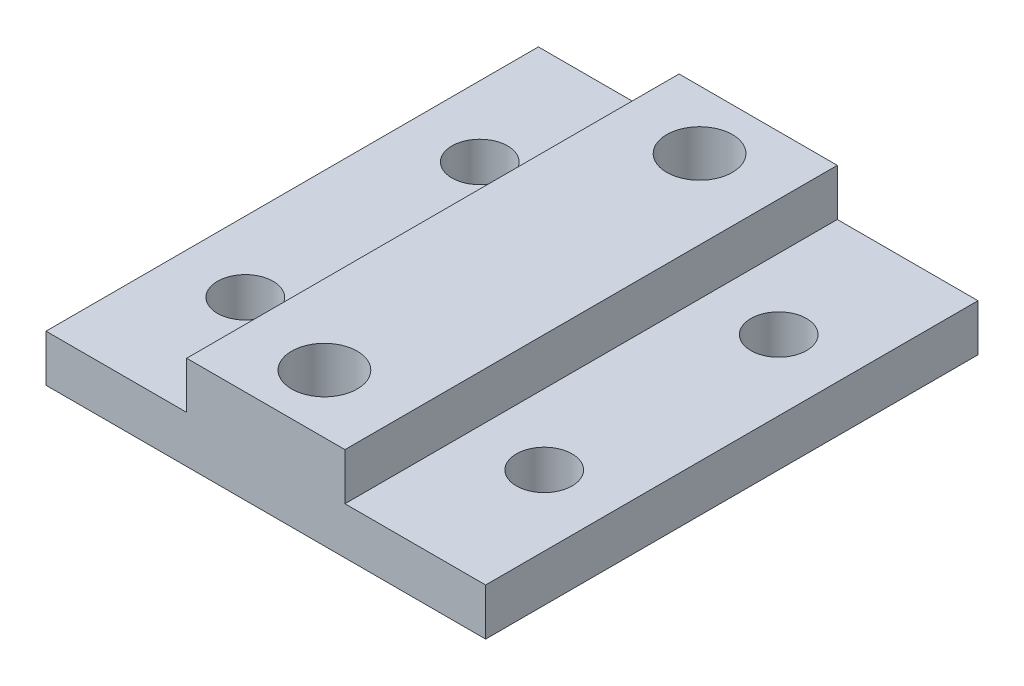
from build123d import *

# Parameters (mm, degrees)
ESBO_O1_W                = 12
ESBO_O1_H                = 42
ESBO_O1_R                = 2.375
ESBO_O1_W_2              = 13.5
ESBO_O1_R_2              = 2.8
RESSALTO_EXTRUS_O1_DEPTH = 5
CORTE_EXTRUS_O1_START    = -5
CORTE_EXTRUS_O1_DEPTH    = 4
RESSALTO_EXTRUS_O2_START = 5
ESBO_O1_3_W              = 13.5
ESBO_O1_3_H              = 42
ESBO_O1_3_R              = 2.8
RESSALTO_EXTRUS_O2_DEPTH = 4


with BuildPart() as part:
    # Esboço1 → Ressalto-extrusão1 (new body)
    # profile 1 of 3: a face of its own
    with BuildSketch(Plane(origin=(0, 0, 0), x_dir=(1, 0, 0), z_dir=(0, 1, 0))):
        with Locations((-12.75, 0)):
            Rectangle(ESBO_O1_W, ESBO_O1_H)
        with Locations(Location((-12.75, -10, 0), (0, 0, 270))):
            Circle(ESBO_O1_R, mode=Mode.SUBTRACT)
        with Locations(Location((-12.75, 10, 0), (0, 0, 270))):
            Circle(ESBO_O1_R, mode=Mode.SUBTRACT)
    # profile 2 of 3: a face of its own
    with BuildSketch(Plane(origin=(0, 0, 0), x_dir=(1, 0, 0), z_dir=(0, 1, 0))):
        Rectangle(ESBO_O1_W_2, ESBO_O1_H)
        with Locations(Location((0, -16, 0), (0, 0, 270))):
            Circle(ESBO_O1_R_2, mode=Mode.SUBTRACT)
        with Locations(Location((0, 16, 0), (0, 0, 270))):
            Circle(ESBO_O1_R_2, mode=Mode.SUBTRACT)
    # profile 3 of 3: a face of its own
    with BuildSketch(Plane(origin=(0, 0, 0), x_dir=(1, 0, 0), z_dir=(0, 1, 0))):
        with Locations((12.75, 0)):
            Rectangle(ESBO_O1_W, ESBO_O1_H)
        with Locations(Location((12.75, -10, 0), (0, 0, 270))):
            Circle(ESBO_O1_R, mode=Mode.SUBTRACT)
        with Locations(Location((12.75, 10, 0), (0, 0, 270))):
            Circle(ESBO_O1_R, mode=Mode.SUBTRACT)
    extrude(amount=RESSALTO_EXTRUS_O1_DEPTH)

    # Esboço2 → Corte-extrusão1 (cut)
    with BuildSketch(Plane(origin=(0, 5, 0), x_dir=(1, 0, 0), z_dir=(0, 1, 0)).offset(CORTE_EXTRUS_O1_START)):
        Polygon((5.022947342, 16), (2.511473671, 20.35), (-2.511473671, 20.35), (-5.022947342, 16), (-2.511473671, 11.65), (2.511473671, 11.65), align=None)
        Polygon((5.022947342, -16), (2.511473671, -11.65), (-2.511473671, -11.65), (-5.022947342, -16), (-2.511473671, -20.35), (2.511473671, -20.35), align=None)
    extrude(amount=CORTE_EXTRUS_O1_DEPTH, mode=Mode.SUBTRACT)

    # Esboço1<3> → Ressalto-extrusão2 (add)
    with BuildSketch(Plane(origin=(0, 0, 0), x_dir=(1, 0, 0), z_dir=(0, 1, 0)).offset(RESSALTO_EXTRUS_O2_START)):
        Rectangle(ESBO_O1_3_W, ESBO_O1_3_H)
        with Locations(Location((0, -16, 0), (0, 0, 270))):
            Circle(ESBO_O1_3_R, mode=Mode.SUBTRACT)
        with Locations(Location((0, 16, 0), (0, 0, 270))):
            Circle(ESBO_O1_3_R, mode=Mode.SUBTRACT)
    extrude(amount=RESSALTO_EXTRUS_O2_DEPTH)

    # Chanfro1
    # the kernel refuses this chamfer: 1 mm, written as the material it takes off along each edge
    with BuildSketch(Plane(origin=(12.75, 0, -10), x_dir=(0, 0, 1), z_dir=(-1, 0, 0))) as chanfro1_piece_1:
        with BuildLine():
            Line((2.346715729, 1.028284271), (3.403284271, -0.028284271))
            Line((3.403284271, -0.028284271), (3.403284271, -0.048284271))
            ThreePointArc((3.403284271, -0.048284271), (2.889142136, -0.02), (2.375, -0.02))
            Line((2.375, -0.02), (2.355, 0))
            ThreePointArc((2.355, 0), (2.355, 0.514142136), (2.326715729, 1.028284271))
            Line((2.326715729, 1.028284271), (2.346715729, 1.028284271))
        make_face()
    revolve(axis=Axis((12.75, 0, -10), (0, 1, 0)), mode=Mode.SUBTRACT)
    with BuildSketch(Plane(origin=(12.75, 0, 10), x_dir=(0, 0, 1), z_dir=(-1, 0, 0))) as chanfro1_piece_2:
        with BuildLine():
            Line((2.346715729, 1.028284271), (3.403284271, -0.028284271))
            Line((3.403284271, -0.028284271), (3.403284271, -0.048284271))
            ThreePointArc((3.403284271, -0.048284271), (2.889142136, -0.02), (2.375, -0.02))
            Line((2.375, -0.02), (2.355, 0))
            ThreePointArc((2.355, 0), (2.355, 0.514142136), (2.326715729, 1.028284271))
            Line((2.326715729, 1.028284271), (2.346715729, 1.028284271))
        make_face()
    revolve(axis=Axis((12.75, 0, 10), (0, 1, 0)), mode=Mode.SUBTRACT)
    with BuildSketch(Plane(origin=(-18.75, 0, -21), x_dir=(0.9996219169112968, -0.02749587661058639, 0), z_dir=(0, 0, 1))) as chanfro1_piece_3:
        with BuildLine():
            Line((1.028673195, 0), (-0.056547155, 1.027117794))
            Line((-0.056547155, 1.027117794), (-0.076539593, 1.026567876))
            ThreePointArc((-0.076539593, 1.026567876), (-0.034129227, 0.51339783), (-0.019992438, -0.000549918))
            Line((-0.019992438, -0.000549918), (0.000549918, -0.019992438))
            ThreePointArc((0.000549918, -0.019992438), (0.514497665, -0.00585565), (1.029223113, -0.019992438))
            Line((1.029223113, -0.019992438), (1.028673195, 0))
        make_face()
    extrude(amount=42, mode=Mode.SUBTRACT)
    with BuildSketch(Plane(origin=(18.75, 0, -21), x_dir=(0, 0.9996219169112968, -0.02749587661058563), z_dir=(-1, 0, 0))) as chanfro1_piece_4:
        with BuildLine():
            Line((1.028673195, 0), (-0.056547155, -1.027117794))
            Line((-0.056547155, -1.027117794), (-0.076539593, -1.026567876))
            ThreePointArc((-0.076539593, -1.026567876), (-0.034129227, -0.51339783), (-0.019992438, 0.000549918))
            Line((-0.019992438, 0.000549918), (0.000549918, 0.019992438))
            ThreePointArc((0.000549918, 0.019992438), (0.514497665, 0.00585565), (1.029223113, 0.019992438))
            Line((1.029223113, 0.019992438), (1.028673195, 0))
        make_face()
    extrude(amount=37.5, mode=Mode.SUBTRACT)
    with BuildSketch(Plane(origin=(18.75, 0, 21), x_dir=(0.02749587661058563, 0.9996219169112968, 0), z_dir=(0, 0, -1))) as chanfro1_piece_5:
        with BuildLine():
            Line((1.028673195, 0), (-0.056547155, -1.027117794))
            Line((-0.056547155, -1.027117794), (-0.076539593, -1.026567876))
            ThreePointArc((-0.076539593, -1.026567876), (-0.034129227, -0.51339783), (-0.019992438, 0.000549918))
            Line((-0.019992438, 0.000549918), (0.000549918, 0.019992438))
            ThreePointArc((0.000549918, 0.019992438), (0.514497665, 0.00585565), (1.029223113, 0.019992438))
            Line((1.029223113, 0.019992438), (1.028673195, 0))
        make_face()
    extrude(amount=42, mode=Mode.SUBTRACT)
    with BuildSketch(Plane(origin=(18.75, 0, 21), x_dir=(0, 0.999621916911297, 0.027495876610582174), z_dir=(-1, 0, 0))) as chanfro1_piece_6:
        with BuildLine():
            Line((1.028673195, 0), (-0.056547155, 1.027117794))
            Line((-0.056547155, 1.027117794), (-0.076539593, 1.026567876))
            ThreePointArc((-0.076539593, 1.026567876), (-0.034129227, 0.51339783), (-0.019992438, -0.000549918))
            Line((-0.019992438, -0.000549918), (0.000549918, -0.019992438))
            ThreePointArc((0.000549918, -0.019992438), (0.514497665, -0.00585565), (1.029223113, -0.019992438))
            Line((1.029223113, -0.019992438), (1.028673195, 0))
        make_face()
    extrude(amount=37.5, mode=Mode.SUBTRACT)
    with BuildSketch(Plane(origin=(-12.75, 0, -10), x_dir=(0, 0, 1), z_dir=(-1, 0, 0))) as chanfro1_piece_7:
        with BuildLine():
            Line((2.346715729, 1.028284271), (3.403284271, -0.028284271))
            Line((3.403284271, -0.028284271), (3.403284271, -0.048284271))
            ThreePointArc((3.403284271, -0.048284271), (2.889142136, -0.02), (2.375, -0.02))
            Line((2.375, -0.02), (2.355, 0))
            ThreePointArc((2.355, 0), (2.355, 0.514142136), (2.326715729, 1.028284271))
            Line((2.326715729, 1.028284271), (2.346715729, 1.028284271))
        make_face()
    revolve(axis=Axis((-12.75, 0, -10), (0, 1, 0)), mode=Mode.SUBTRACT)
    with BuildSketch(Plane(origin=(-12.75, 0, 10), x_dir=(0, 0, 1), z_dir=(-1, 0, 0))) as chanfro1_piece_8:
        with BuildLine():
            Line((2.346715729, 1.028284271), (3.403284271, -0.028284271))
            Line((3.403284271, -0.028284271), (3.403284271, -0.048284271))
            ThreePointArc((3.403284271, -0.048284271), (2.889142136, -0.02), (2.375, -0.02))
            Line((2.375, -0.02), (2.355, 0))
            ThreePointArc((2.355, 0), (2.355, 0.514142136), (2.326715729, 1.028284271))
            Line((2.326715729, 1.028284271), (2.346715729, 1.028284271))
        make_face()
    revolve(axis=Axis((-12.75, 0, 10), (0, 1, 0)), mode=Mode.SUBTRACT)
    with BuildSketch(Plane(origin=(1.225632177, 0, -9.422857202), x_dir=(-0.023812127644090058, 0.9996219169112968, -0.013747938305293108), z_dir=(0.4999999999999996, 0, -0.8660254037844389))) as chanfro1_piece_9_section:
        with BuildLine():
            Line((1.028673195, 0), (-0.056547155, 1.027117794))
            Line((-0.056547155, 1.027117794), (-0.076539593, 1.026567876))
            ThreePointArc((-0.076539593, 1.026567876), (-0.034129227, 0.51339783), (-0.019992438, -0.000549918))
            Line((-0.019992438, -0.000549918), (0.000549918, -0.019992438))
            ThreePointArc((0.000549918, -0.019992438), (0.514497665, -0.00585565), (1.029223113, -0.019992438))
            Line((1.029223113, -0.019992438), (1.028673195, 0))
        make_face()
    chanfro1_piece_9 = extrude(amount=10.166313318, mode=Mode.PRIVATE)
    chanfro1_piece_9 = split(chanfro1_piece_9, bisect_by=Plane(origin=(4.039140565, 0.338238152, -11.65), z_dir=(0, 0, -1)), keep=Keep.TOP, mode=Mode.PRIVATE)
    chanfro1_piece_9 = split(chanfro1_piece_9, bisect_by=Plane(origin=(5.786780789, 0.338238152, -14.677001661), z_dir=(-0.8660254037844387, 0, 0.49999999999999994)), keep=Keep.TOP, mode=Mode.PRIVATE)
    add(chanfro1_piece_9, mode=Mode.SUBTRACT)
    with BuildSketch(Plane(origin=(6.308788836, 0, -13.772857202), x_dir=(-0.023812127644088424, 0.9996219169112968, 0.013747938305292178), z_dir=(-0.49999999999999994, 0, -0.8660254037844387))) as chanfro1_piece_10_section:
        with BuildLine():
            Line((1.028673195, 0), (-0.056547155, 1.027117794))
            Line((-0.056547155, 1.027117794), (-0.076539593, 1.026567876))
            ThreePointArc((-0.076539593, 1.026567876), (-0.034129227, 0.51339783), (-0.019992438, -0.000549918))
            Line((-0.019992438, -0.000549918), (0.000549918, -0.019992438))
            ThreePointArc((0.000549918, -0.019992438), (0.514497665, -0.00585565), (1.029223113, -0.019992438))
            Line((1.029223113, -0.019992438), (1.028673195, 0))
        make_face()
    chanfro1_piece_10 = extrude(amount=10.166313318, mode=Mode.PRIVATE)
    chanfro1_piece_10 = split(chanfro1_piece_10, bisect_by=Plane(origin=(4.039140565, 0.338238152, -20.35), z_dir=(0, 0, 1)), keep=Keep.TOP, mode=Mode.PRIVATE)
    chanfro1_piece_10 = split(chanfro1_piece_10, bisect_by=Plane(origin=(5.786780789, 0.338238152, -17.322998339), z_dir=(-0.8660254037844389, 0, -0.4999999999999996)), keep=Keep.TOP, mode=Mode.PRIVATE)
    add(chanfro1_piece_10, mode=Mode.SUBTRACT)
    with BuildSketch(Plane(origin=(5.083156659, 0, -20.35), x_dir=(0, 0.9996219169112968, 0.02749587661058563), z_dir=(-1, 0, 0))) as chanfro1_piece_11_section:
        with BuildLine():
            Line((1.028673195, 0), (-0.056547155, 1.027117794))
            Line((-0.056547155, 1.027117794), (-0.076539593, 1.026567876))
            ThreePointArc((-0.076539593, 1.026567876), (-0.034129227, 0.51339783), (-0.019992438, -0.000549918))
            Line((-0.019992438, -0.000549918), (0.000549918, -0.019992438))
            ThreePointArc((0.000549918, -0.019992438), (0.514497665, -0.00585565), (1.029223113, -0.019992438))
            Line((1.029223113, -0.019992438), (1.028673195, 0))
        make_face()
    chanfro1_piece_11 = extrude(amount=10.166313318, mode=Mode.PRIVATE)
    chanfro1_piece_11 = split(chanfro1_piece_11, bisect_by=Plane(origin=(-1.747640224, 0.338238152, -21.672998339), z_dir=(0.8660254037844389, 0, 0.49999999999999967)), keep=Keep.TOP, mode=Mode.PRIVATE)
    chanfro1_piece_11 = split(chanfro1_piece_11, bisect_by=Plane(origin=(1.747640224, 0.338238152, -21.672998339), z_dir=(-0.8660254037844387, 0, 0.49999999999999994)), keep=Keep.TOP, mode=Mode.PRIVATE)
    add(chanfro1_piece_11, mode=Mode.SUBTRACT)
    with BuildSketch(Plane(origin=(-1.225632177, 0, -22.577142798), x_dir=(0.023812127644090766, 0.9996219169112968, 0.013747938305293517), z_dir=(-0.49999999999999967, 0, 0.8660254037844389))) as chanfro1_piece_12_section:
        with BuildLine():
            Line((1.028673195, 0), (-0.056547155, 1.027117794))
            Line((-0.056547155, 1.027117794), (-0.076539593, 1.026567876))
            ThreePointArc((-0.076539593, 1.026567876), (-0.034129227, 0.51339783), (-0.019992438, -0.000549918))
            Line((-0.019992438, -0.000549918), (0.000549918, -0.019992438))
            ThreePointArc((0.000549918, -0.019992438), (0.514497665, -0.00585565), (1.029223113, -0.019992438))
            Line((1.029223113, -0.019992438), (1.028673195, 0))
        make_face()
    chanfro1_piece_12 = extrude(amount=10.166313318, mode=Mode.PRIVATE)
    chanfro1_piece_12 = split(chanfro1_piece_12, bisect_by=Plane(origin=(-5.786780789, 0.338238152, -17.322998339), z_dir=(0.8660254037844387, 0, -0.5000000000000001)), keep=Keep.TOP, mode=Mode.PRIVATE)
    chanfro1_piece_12 = split(chanfro1_piece_12, bisect_by=Plane(origin=(-4.039140565, 0.338238152, -20.35), z_dir=(0, 0, 1)), keep=Keep.TOP, mode=Mode.PRIVATE)
    add(chanfro1_piece_12, mode=Mode.SUBTRACT)
    with BuildSketch(Plane(origin=(-6.308788836, 0, -18.227142798), x_dir=(0.02381212764409112, 0.9996219169112968, -0.01374793830529374), z_dir=(0.5000000000000001, 0, 0.8660254037844387))) as chanfro1_piece_13_section:
        with BuildLine():
            Line((1.028673195, 0), (-0.056547155, 1.027117794))
            Line((-0.056547155, 1.027117794), (-0.076539593, 1.026567876))
            ThreePointArc((-0.076539593, 1.026567876), (-0.034129227, 0.51339783), (-0.019992438, -0.000549918))
            Line((-0.019992438, -0.000549918), (0.000549918, -0.019992438))
            ThreePointArc((0.000549918, -0.019992438), (0.514497665, -0.00585565), (1.029223113, -0.019992438))
            Line((1.029223113, -0.019992438), (1.028673195, 0))
        make_face()
    chanfro1_piece_13 = extrude(amount=10.166313318, mode=Mode.PRIVATE)
    chanfro1_piece_13 = split(chanfro1_piece_13, bisect_by=Plane(origin=(-5.786780789, 0.338238152, -14.677001661), z_dir=(0.8660254037844389, 0, 0.49999999999999967)), keep=Keep.TOP, mode=Mode.PRIVATE)
    chanfro1_piece_13 = split(chanfro1_piece_13, bisect_by=Plane(origin=(-4.039140565, 0.338238152, -11.65), z_dir=(0, 0, -1)), keep=Keep.TOP, mode=Mode.PRIVATE)
    add(chanfro1_piece_13, mode=Mode.SUBTRACT)
    with BuildSketch(Plane(origin=(-5.083156659, 0, -11.65), x_dir=(0, 0.9996219169112968, -0.02749587661058563), z_dir=(1, 0, 0))) as chanfro1_piece_14_section:
        with BuildLine():
            Line((1.028673195, 0), (-0.056547155, 1.027117794))
            Line((-0.056547155, 1.027117794), (-0.076539593, 1.026567876))
            ThreePointArc((-0.076539593, 1.026567876), (-0.034129227, 0.51339783), (-0.019992438, -0.000549918))
            Line((-0.019992438, -0.000549918), (0.000549918, -0.019992438))
            ThreePointArc((0.000549918, -0.019992438), (0.514497665, -0.00585565), (1.029223113, -0.019992438))
            Line((1.029223113, -0.019992438), (1.028673195, 0))
        make_face()
    chanfro1_piece_14 = extrude(amount=10.166313318, mode=Mode.PRIVATE)
    chanfro1_piece_14 = split(chanfro1_piece_14, bisect_by=Plane(origin=(-1.747640224, 0.338238152, -10.327001661), z_dir=(0.8660254037844387, 0, -0.5000000000000001)), keep=Keep.TOP, mode=Mode.PRIVATE)
    chanfro1_piece_14 = split(chanfro1_piece_14, bisect_by=Plane(origin=(1.747640224, 0.338238152, -10.327001661), z_dir=(-0.8660254037844389, 0, -0.4999999999999996)), keep=Keep.TOP, mode=Mode.PRIVATE)
    add(chanfro1_piece_14, mode=Mode.SUBTRACT)
    with BuildSketch(Plane(origin=(1.225632177, 0, 22.577142798), x_dir=(-0.023812127644090682, 0.9996219169112968, -0.013747938305293464), z_dir=(0.49999999999999944, 0, -0.866025403784439))) as chanfro1_piece_15_section:
        with BuildLine():
            Line((1.028673195, 0), (-0.056547155, 1.027117794))
            Line((-0.056547155, 1.027117794), (-0.076539593, 1.026567876))
            ThreePointArc((-0.076539593, 1.026567876), (-0.034129227, 0.51339783), (-0.019992438, -0.000549918))
            Line((-0.019992438, -0.000549918), (0.000549918, -0.019992438))
            ThreePointArc((0.000549918, -0.019992438), (0.514497665, -0.00585565), (1.029223113, -0.019992438))
            Line((1.029223113, -0.019992438), (1.028673195, 0))
        make_face()
    chanfro1_piece_15 = extrude(amount=10.166313318, mode=Mode.PRIVATE)
    chanfro1_piece_15 = split(chanfro1_piece_15, bisect_by=Plane(origin=(4.039140565, 0.338238152, 20.35), z_dir=(0, 0, -1)), keep=Keep.TOP, mode=Mode.PRIVATE)
    chanfro1_piece_15 = split(chanfro1_piece_15, bisect_by=Plane(origin=(5.786780789, 0.338238152, 17.322998339), z_dir=(-0.8660254037844387, 0, 0.5000000000000003)), keep=Keep.TOP, mode=Mode.PRIVATE)
    add(chanfro1_piece_15, mode=Mode.SUBTRACT)
    with BuildSketch(Plane(origin=(6.308788836, 0, 18.227142798), x_dir=(-0.02381212764409067, 0.9996219169112968, 0.013747938305293488), z_dir=(-0.5000000000000003, 0, -0.8660254037844386))) as chanfro1_piece_16_section:
        with BuildLine():
            Line((1.028673195, 0), (-0.056547155, 1.027117794))
            Line((-0.056547155, 1.027117794), (-0.076539593, 1.026567876))
            ThreePointArc((-0.076539593, 1.026567876), (-0.034129227, 0.51339783), (-0.019992438, -0.000549918))
            Line((-0.019992438, -0.000549918), (0.000549918, -0.019992438))
            ThreePointArc((0.000549918, -0.019992438), (0.514497665, -0.00585565), (1.029223113, -0.019992438))
            Line((1.029223113, -0.019992438), (1.028673195, 0))
        make_face()
    chanfro1_piece_16 = extrude(amount=10.166313318, mode=Mode.PRIVATE)
    chanfro1_piece_16 = split(chanfro1_piece_16, bisect_by=Plane(origin=(4.039140565, 0.338238152, 11.65), z_dir=(0, 0, 1)), keep=Keep.TOP, mode=Mode.PRIVATE)
    chanfro1_piece_16 = split(chanfro1_piece_16, bisect_by=Plane(origin=(5.786780789, 0.338238152, 14.677001661), z_dir=(-0.866025403784439, 0, -0.49999999999999944)), keep=Keep.TOP, mode=Mode.PRIVATE)
    add(chanfro1_piece_16, mode=Mode.SUBTRACT)
    with BuildSketch(Plane(origin=(5.083156659, 0, 11.65), x_dir=(0, 0.9996219169112968, 0.02749587661058563), z_dir=(-1, 0, 0))) as chanfro1_piece_17_section:
        with BuildLine():
            Line((1.028673195, 0), (-0.056547155, 1.027117794))
            Line((-0.056547155, 1.027117794), (-0.076539593, 1.026567876))
            ThreePointArc((-0.076539593, 1.026567876), (-0.034129227, 0.51339783), (-0.019992438, -0.000549918))
            Line((-0.019992438, -0.000549918), (0.000549918, -0.019992438))
            ThreePointArc((0.000549918, -0.019992438), (0.514497665, -0.00585565), (1.029223113, -0.019992438))
            Line((1.029223113, -0.019992438), (1.028673195, 0))
        make_face()
    chanfro1_piece_17 = extrude(amount=10.166313318, mode=Mode.PRIVATE)
    chanfro1_piece_17 = split(chanfro1_piece_17, bisect_by=Plane(origin=(-1.747640224, 0.338238152, 10.327001661), z_dir=(0.8660254037844387, 0, 0.5000000000000001)), keep=Keep.TOP, mode=Mode.PRIVATE)
    chanfro1_piece_17 = split(chanfro1_piece_17, bisect_by=Plane(origin=(1.747640224, 0.338238152, 10.327001661), z_dir=(-0.8660254037844387, 0, 0.5000000000000003)), keep=Keep.TOP, mode=Mode.PRIVATE)
    add(chanfro1_piece_17, mode=Mode.SUBTRACT)
    with BuildSketch(Plane(origin=(-1.225632177, 0, 9.422857202), x_dir=(0.023812127644089787, 0.9996219169112968, 0.01374793830529297), z_dir=(-0.5000000000000001, 0, 0.8660254037844387))) as chanfro1_piece_18_section:
        with BuildLine():
            Line((1.028673195, 0), (-0.056547155, 1.027117794))
            Line((-0.056547155, 1.027117794), (-0.076539593, 1.026567876))
            ThreePointArc((-0.076539593, 1.026567876), (-0.034129227, 0.51339783), (-0.019992438, -0.000549918))
            Line((-0.019992438, -0.000549918), (0.000549918, -0.019992438))
            ThreePointArc((0.000549918, -0.019992438), (0.514497665, -0.00585565), (1.029223113, -0.019992438))
            Line((1.029223113, -0.019992438), (1.028673195, 0))
        make_face()
    chanfro1_piece_18 = extrude(amount=10.166313318, mode=Mode.PRIVATE)
    chanfro1_piece_18 = split(chanfro1_piece_18, bisect_by=Plane(origin=(-5.786780789, 0.338238152, 14.677001661), z_dir=(0.8660254037844388, 0, -0.4999999999999998)), keep=Keep.TOP, mode=Mode.PRIVATE)
    chanfro1_piece_18 = split(chanfro1_piece_18, bisect_by=Plane(origin=(-4.039140565, 0.338238152, 11.65), z_dir=(0, 0, 1)), keep=Keep.TOP, mode=Mode.PRIVATE)
    add(chanfro1_piece_18, mode=Mode.SUBTRACT)
    with BuildSketch(Plane(origin=(-6.308788836, 0, 13.772857202), x_dir=(0.023812127644090478, 0.9996219169112968, -0.013747938305293358), z_dir=(0.4999999999999998, 0, 0.8660254037844388))) as chanfro1_piece_19_section:
        with BuildLine():
            Line((1.028673195, 0), (-0.056547155, 1.027117794))
            Line((-0.056547155, 1.027117794), (-0.076539593, 1.026567876))
            ThreePointArc((-0.076539593, 1.026567876), (-0.034129227, 0.51339783), (-0.019992438, -0.000549918))
            Line((-0.019992438, -0.000549918), (0.000549918, -0.019992438))
            ThreePointArc((0.000549918, -0.019992438), (0.514497665, -0.00585565), (1.029223113, -0.019992438))
            Line((1.029223113, -0.019992438), (1.028673195, 0))
        make_face()
    chanfro1_piece_19 = extrude(amount=10.166313318, mode=Mode.PRIVATE)
    chanfro1_piece_19 = split(chanfro1_piece_19, bisect_by=Plane(origin=(-5.786780789, 0.338238152, 17.322998339), z_dir=(0.8660254037844387, 0, 0.5000000000000001)), keep=Keep.TOP, mode=Mode.PRIVATE)
    chanfro1_piece_19 = split(chanfro1_piece_19, bisect_by=Plane(origin=(-4.039140565, 0.338238152, 20.35), z_dir=(0, 0, -1)), keep=Keep.TOP, mode=Mode.PRIVATE)
    add(chanfro1_piece_19, mode=Mode.SUBTRACT)
    with BuildSketch(Plane(origin=(-5.083156659, 0, 20.35), x_dir=(0, 0.9996219169112968, -0.02749587661058563), z_dir=(1, 0, 0))) as chanfro1_piece_20_section:
        with BuildLine():
            Line((1.028673195, 0), (-0.056547155, 1.027117794))
            Line((-0.056547155, 1.027117794), (-0.076539593, 1.026567876))
            ThreePointArc((-0.076539593, 1.026567876), (-0.034129227, 0.51339783), (-0.019992438, -0.000549918))
            Line((-0.019992438, -0.000549918), (0.000549918, -0.019992438))
            ThreePointArc((0.000549918, -0.019992438), (0.514497665, -0.00585565), (1.029223113, -0.019992438))
            Line((1.029223113, -0.019992438), (1.028673195, 0))
        make_face()
    chanfro1_piece_20 = extrude(amount=10.166313318, mode=Mode.PRIVATE)
    chanfro1_piece_20 = split(chanfro1_piece_20, bisect_by=Plane(origin=(-1.747640224, 0.338238152, 21.672998339), z_dir=(0.8660254037844388, 0, -0.4999999999999998)), keep=Keep.TOP, mode=Mode.PRIVATE)
    chanfro1_piece_20 = split(chanfro1_piece_20, bisect_by=Plane(origin=(1.747640224, 0.338238152, 21.672998339), z_dir=(-0.866025403784439, 0, -0.49999999999999944)), keep=Keep.TOP, mode=Mode.PRIVATE)
    add(chanfro1_piece_20, mode=Mode.SUBTRACT)
    with BuildSketch(Plane(origin=(18.75, 0, -21), x_dir=(0, 0.9996219169112968, -0.02749587661058563), z_dir=(-1, 0, 0))) as chanfro1_piece_21a_section:
        with BuildLine():
            Line((1.028673195, 0), (-0.056547155, -1.027117794))
            Line((-0.056547155, -1.027117794), (-0.076539593, -1.026567876))
            ThreePointArc((-0.076539593, -1.026567876), (-0.034129227, -0.51339783), (-0.019992438, 0.000549918))
            Line((-0.019992438, 0.000549918), (0.000549918, 0.019992438))
            ThreePointArc((0.000549918, 0.019992438), (0.514497665, 0.00585565), (1.029223113, 0.019992438))
            Line((1.029223113, 0.019992438), (1.028673195, 0))
        make_face()
    chanfro1_piece_21a = extrude(amount=40.071682988, mode=Mode.PRIVATE)
    chanfro1_piece_21a = split(chanfro1_piece_21a, bisect_by=Plane(origin=(-18.75, 0.329793627, -20.670206373), z_dir=(-1, 0, 0)), keep=Keep.TOP, mode=Mode.PRIVATE)
    with BuildSketch(Plane(origin=(-18.75, 0, -23.571682988), x_dir=(0.9996219169112968, -0.02749587661058639, 0), z_dir=(0, 0, 1))) as chanfro1_piece_21b_section:
        with BuildLine():
            Line((1.028673195, 0), (-0.056547155, 1.027117794))
            Line((-0.056547155, 1.027117794), (-0.076539593, 1.026567876))
            ThreePointArc((-0.076539593, 1.026567876), (-0.034129227, 0.51339783), (-0.019992438, -0.000549918))
            Line((-0.019992438, -0.000549918), (0.000549918, -0.019992438))
            ThreePointArc((0.000549918, -0.019992438), (0.514497665, -0.00585565), (1.029223113, -0.019992438))
            Line((1.029223113, -0.019992438), (1.028673195, 0))
        make_face()
    chanfro1_piece_21b = extrude(amount=44.571682988, mode=Mode.PRIVATE)
    chanfro1_piece_21b = split(chanfro1_piece_21b, bisect_by=Plane(origin=(-18.420206373, 0.329793627, -21), z_dir=(0, 0, -1)), keep=Keep.TOP, mode=Mode.PRIVATE)
    chanfro1_piece_21 = chanfro1_piece_21a & chanfro1_piece_21b
    add(chanfro1_piece_21, mode=Mode.SUBTRACT)
    with BuildSketch(Plane(origin=(18.75, 0, 21), x_dir=(0, 0.999621916911297, 0.027495876610582174), z_dir=(-1, 0, 0))) as chanfro1_piece_22a_section:
        with BuildLine():
            Line((1.028673195, 0), (-0.056547155, 1.027117794))
            Line((-0.056547155, 1.027117794), (-0.076539593, 1.026567876))
            ThreePointArc((-0.076539593, 1.026567876), (-0.034129227, 0.51339783), (-0.019992438, -0.000549918))
            Line((-0.019992438, -0.000549918), (0.000549918, -0.019992438))
            ThreePointArc((0.000549918, -0.019992438), (0.514497665, -0.00585565), (1.029223113, -0.019992438))
            Line((1.029223113, -0.019992438), (1.028673195, 0))
        make_face()
    chanfro1_piece_22a = extrude(amount=40.071682988, mode=Mode.PRIVATE)
    chanfro1_piece_22a = split(chanfro1_piece_22a, bisect_by=Plane(origin=(-18.75, 0.329793627, 20.670206373), z_dir=(-1, 0, 0)), keep=Keep.TOP, mode=Mode.PRIVATE)
    with BuildSketch(Plane(origin=(-18.75, 0, -21), x_dir=(0.9996219169112968, -0.02749587661058639, 0), z_dir=(0, 0, 1))) as chanfro1_piece_22b_section:
        with BuildLine():
            Line((1.028673195, 0), (-0.056547155, 1.027117794))
            Line((-0.056547155, 1.027117794), (-0.076539593, 1.026567876))
            ThreePointArc((-0.076539593, 1.026567876), (-0.034129227, 0.51339783), (-0.019992438, -0.000549918))
            Line((-0.019992438, -0.000549918), (0.000549918, -0.019992438))
            ThreePointArc((0.000549918, -0.019992438), (0.514497665, -0.00585565), (1.029223113, -0.019992438))
            Line((1.029223113, -0.019992438), (1.028673195, 0))
        make_face()
    chanfro1_piece_22b = extrude(amount=44.571682988, mode=Mode.PRIVATE)
    chanfro1_piece_22b = split(chanfro1_piece_22b, bisect_by=Plane(origin=(-18.420206373, 0.329793627, 21), z_dir=(0, 0, 1)), keep=Keep.TOP, mode=Mode.PRIVATE)
    chanfro1_piece_22 = chanfro1_piece_22a & chanfro1_piece_22b
    add(chanfro1_piece_22, mode=Mode.SUBTRACT)
    with BuildSketch(Plane(origin=(21.321682988, 0, -21), x_dir=(0, 0.9996219169112968, -0.02749587661058563), z_dir=(-1, 0, 0))) as chanfro1_piece_23a_section:
        with BuildLine():
            Line((1.028673195, 0), (-0.056547155, -1.027117794))
            Line((-0.056547155, -1.027117794), (-0.076539593, -1.026567876))
            ThreePointArc((-0.076539593, -1.026567876), (-0.034129227, -0.51339783), (-0.019992438, 0.000549918))
            Line((-0.019992438, 0.000549918), (0.000549918, 0.019992438))
            ThreePointArc((0.000549918, 0.019992438), (0.514497665, 0.00585565), (1.029223113, 0.019992438))
            Line((1.029223113, 0.019992438), (1.028673195, 0))
        make_face()
    chanfro1_piece_23a = extrude(amount=40.071682988, mode=Mode.PRIVATE)
    chanfro1_piece_23a = split(chanfro1_piece_23a, bisect_by=Plane(origin=(18.75, 0.329793627, -20.670206373), z_dir=(1, 0, 0)), keep=Keep.TOP, mode=Mode.PRIVATE)
    with BuildSketch(Plane(origin=(18.75, 0, 21), x_dir=(0.02749587661058563, 0.9996219169112968, 0), z_dir=(0, 0, -1))) as chanfro1_piece_23b_section:
        with BuildLine():
            Line((1.028673195, 0), (-0.056547155, -1.027117794))
            Line((-0.056547155, -1.027117794), (-0.076539593, -1.026567876))
            ThreePointArc((-0.076539593, -1.026567876), (-0.034129227, -0.51339783), (-0.019992438, 0.000549918))
            Line((-0.019992438, 0.000549918), (0.000549918, 0.019992438))
            ThreePointArc((0.000549918, 0.019992438), (0.514497665, 0.00585565), (1.029223113, 0.019992438))
            Line((1.029223113, 0.019992438), (1.028673195, 0))
        make_face()
    chanfro1_piece_23b = extrude(amount=44.571682988, mode=Mode.PRIVATE)
    chanfro1_piece_23b = split(chanfro1_piece_23b, bisect_by=Plane(origin=(18.420206373, 0.329793627, -21), z_dir=(0, 0, -1)), keep=Keep.TOP, mode=Mode.PRIVATE)
    chanfro1_piece_23 = chanfro1_piece_23a & chanfro1_piece_23b
    add(chanfro1_piece_23, mode=Mode.SUBTRACT)
    with BuildSketch(Plane(origin=(21.321682988, 0, 21), x_dir=(0, 0.9996219169112968, 0.02749587661058563), z_dir=(-1, 0, 0))) as chanfro1_piece_24a_section:
        with BuildLine():
            Line((1.028673195, 0), (-0.056547155, 1.027117794))
            Line((-0.056547155, 1.027117794), (-0.076539593, 1.026567876))
            ThreePointArc((-0.076539593, 1.026567876), (-0.034129227, 0.51339783), (-0.019992438, -0.000549918))
            Line((-0.019992438, -0.000549918), (0.000549918, -0.019992438))
            ThreePointArc((0.000549918, -0.019992438), (0.514497665, -0.00585565), (1.029223113, -0.019992438))
            Line((1.029223113, -0.019992438), (1.028673195, 0))
        make_face()
    chanfro1_piece_24a = extrude(amount=40.071682988, mode=Mode.PRIVATE)
    chanfro1_piece_24a = split(chanfro1_piece_24a, bisect_by=Plane(origin=(18.75, 0.329793627, 20.670206373), z_dir=(1, 0, 0)), keep=Keep.TOP, mode=Mode.PRIVATE)
    with BuildSketch(Plane(origin=(18.75, 0, 23.571682988), x_dir=(0.02749587661058563, 0.9996219169112968, 0), z_dir=(0, 0, -1))) as chanfro1_piece_24b_section:
        with BuildLine():
            Line((1.028673195, 0), (-0.056547155, -1.027117794))
            Line((-0.056547155, -1.027117794), (-0.076539593, -1.026567876))
            ThreePointArc((-0.076539593, -1.026567876), (-0.034129227, -0.51339783), (-0.019992438, 0.000549918))
            Line((-0.019992438, 0.000549918), (0.000549918, 0.019992438))
            ThreePointArc((0.000549918, 0.019992438), (0.514497665, 0.00585565), (1.029223113, 0.019992438))
            Line((1.029223113, 0.019992438), (1.028673195, 0))
        make_face()
    chanfro1_piece_24b = extrude(amount=44.571682988, mode=Mode.PRIVATE)
    chanfro1_piece_24b = split(chanfro1_piece_24b, bisect_by=Plane(origin=(18.420206373, 0.329793627, 21), z_dir=(0, 0, 1)), keep=Keep.TOP, mode=Mode.PRIVATE)
    chanfro1_piece_24 = chanfro1_piece_24a & chanfro1_piece_24b
    add(chanfro1_piece_24, mode=Mode.SUBTRACT)
    with BuildSketch(Plane(origin=(-5.083156659, 0, -11.65), x_dir=(0, 0.9996219169112968, -0.02749587661058563), z_dir=(1, 0, 0))) as chanfro1_piece_25a_section:
        with BuildLine():
            Line((1.028673195, 0), (-0.056547155, 1.027117794))
            Line((-0.056547155, 1.027117794), (-0.076539593, 1.026567876))
            ThreePointArc((-0.076539593, 1.026567876), (-0.034129227, 0.51339783), (-0.019992438, -0.000549918))
            Line((-0.019992438, -0.000549918), (0.000549918, -0.019992438))
            ThreePointArc((0.000549918, -0.019992438), (0.514497665, -0.00585565), (1.029223113, -0.019992438))
            Line((1.029223113, -0.019992438), (1.028673195, 0))
        make_face()
    chanfro1_piece_25a = extrude(amount=10.166313318, mode=Mode.PRIVATE)
    chanfro1_piece_25a = split(chanfro1_piece_25a, bisect_by=Plane(origin=(2.659622771, 0.322697437, -11.906601768), z_dir=(0.8660254037844389, 0, 0.4999999999999996)), keep=Keep.TOP, mode=Mode.PRIVATE)
    with BuildSketch(Plane(origin=(1.225632177, 0, -9.422857202), x_dir=(-0.023812127644090058, 0.9996219169112968, -0.013747938305293108), z_dir=(0.4999999999999996, 0, -0.8660254037844389))) as chanfro1_piece_25b_section:
        with BuildLine():
            Line((1.028673195, 0), (-0.056547155, 1.027117794))
            Line((-0.056547155, 1.027117794), (-0.076539593, 1.026567876))
            ThreePointArc((-0.076539593, 1.026567876), (-0.034129227, 0.51339783), (-0.019992438, -0.000549918))
            Line((-0.019992438, -0.000549918), (0.000549918, -0.019992438))
            ThreePointArc((0.000549918, -0.019992438), (0.514497665, -0.00585565), (1.029223113, -0.019992438))
            Line((1.029223113, -0.019992438), (1.028673195, 0))
        make_face()
    chanfro1_piece_25b = extrude(amount=10.166313318, mode=Mode.PRIVATE)
    chanfro1_piece_25b = split(chanfro1_piece_25b, bisect_by=Plane(origin=(2.215175471, 0.322697437, -11.65), z_dir=(0, 0, 1)), keep=Keep.TOP, mode=Mode.PRIVATE)
    chanfro1_piece_25 = chanfro1_piece_25a & chanfro1_piece_25b
    add(chanfro1_piece_25, mode=Mode.SUBTRACT)
    with BuildSketch(Plane(origin=(1.225632177, 0, -9.422857202), x_dir=(-0.023812127644090058, 0.9996219169112968, -0.013747938305293108), z_dir=(0.4999999999999996, 0, -0.8660254037844389))) as chanfro1_piece_26a_section:
        with BuildLine():
            Line((1.028673195, 0), (-0.056547155, 1.027117794))
            Line((-0.056547155, 1.027117794), (-0.076539593, 1.026567876))
            ThreePointArc((-0.076539593, 1.026567876), (-0.034129227, 0.51339783), (-0.019992438, -0.000549918))
            Line((-0.019992438, -0.000549918), (0.000549918, -0.019992438))
            ThreePointArc((0.000549918, -0.019992438), (0.514497665, -0.00585565), (1.029223113, -0.019992438))
            Line((1.029223113, -0.019992438), (1.028673195, 0))
        make_face()
    chanfro1_piece_26a = extrude(amount=10.166313318, mode=Mode.PRIVATE)
    chanfro1_piece_26a = split(chanfro1_piece_26a, bisect_by=Plane(origin=(4.874798242, 0.322697437, -16.256601768), z_dir=(0.8660254037844387, 0, -0.49999999999999994)), keep=Keep.TOP, mode=Mode.PRIVATE)
    with BuildSketch(Plane(origin=(6.308788836, 0, -13.772857202), x_dir=(-0.023812127644088424, 0.9996219169112968, 0.013747938305292178), z_dir=(-0.49999999999999994, 0, -0.8660254037844387))) as chanfro1_piece_26b_section:
        with BuildLine():
            Line((1.028673195, 0), (-0.056547155, 1.027117794))
            Line((-0.056547155, 1.027117794), (-0.076539593, 1.026567876))
            ThreePointArc((-0.076539593, 1.026567876), (-0.034129227, 0.51339783), (-0.019992438, -0.000549918))
            Line((-0.019992438, -0.000549918), (0.000549918, -0.019992438))
            ThreePointArc((0.000549918, -0.019992438), (0.514497665, -0.00585565), (1.029223113, -0.019992438))
            Line((1.029223113, -0.019992438), (1.028673195, 0))
        make_face()
    chanfro1_piece_26b = extrude(amount=10.166313318, mode=Mode.PRIVATE)
    chanfro1_piece_26b = split(chanfro1_piece_26b, bisect_by=Plane(origin=(4.874798242, 0.322697437, -15.743398232), z_dir=(0.8660254037844389, 0, 0.4999999999999996)), keep=Keep.TOP, mode=Mode.PRIVATE)
    chanfro1_piece_26 = chanfro1_piece_26a & chanfro1_piece_26b
    add(chanfro1_piece_26, mode=Mode.SUBTRACT)
    with BuildSketch(Plane(origin=(5.083156659, 0, -20.35), x_dir=(0, 0.9996219169112968, 0.02749587661058563), z_dir=(-1, 0, 0))) as chanfro1_piece_27a_section:
        with BuildLine():
            Line((1.028673195, 0), (-0.056547155, 1.027117794))
            Line((-0.056547155, 1.027117794), (-0.076539593, 1.026567876))
            ThreePointArc((-0.076539593, 1.026567876), (-0.034129227, 0.51339783), (-0.019992438, -0.000549918))
            Line((-0.019992438, -0.000549918), (0.000549918, -0.019992438))
            ThreePointArc((0.000549918, -0.019992438), (0.514497665, -0.00585565), (1.029223113, -0.019992438))
            Line((1.029223113, -0.019992438), (1.028673195, 0))
        make_face()
    chanfro1_piece_27a = extrude(amount=10.166313318, mode=Mode.PRIVATE)
    chanfro1_piece_27a = split(chanfro1_piece_27a, bisect_by=Plane(origin=(2.659622771, 0.322697437, -20.093398232), z_dir=(0.8660254037844387, 0, -0.49999999999999994)), keep=Keep.TOP, mode=Mode.PRIVATE)
    with BuildSketch(Plane(origin=(6.308788836, 0, -13.772857202), x_dir=(-0.023812127644088424, 0.9996219169112968, 0.013747938305292178), z_dir=(-0.49999999999999994, 0, -0.8660254037844387))) as chanfro1_piece_27b_section:
        with BuildLine():
            Line((1.028673195, 0), (-0.056547155, 1.027117794))
            Line((-0.056547155, 1.027117794), (-0.076539593, 1.026567876))
            ThreePointArc((-0.076539593, 1.026567876), (-0.034129227, 0.51339783), (-0.019992438, -0.000549918))
            Line((-0.019992438, -0.000549918), (0.000549918, -0.019992438))
            ThreePointArc((0.000549918, -0.019992438), (0.514497665, -0.00585565), (1.029223113, -0.019992438))
            Line((1.029223113, -0.019992438), (1.028673195, 0))
        make_face()
    chanfro1_piece_27b = extrude(amount=10.166313318, mode=Mode.PRIVATE)
    chanfro1_piece_27b = split(chanfro1_piece_27b, bisect_by=Plane(origin=(2.215175471, 0.322697437, -20.35), z_dir=(0, 0, -1)), keep=Keep.TOP, mode=Mode.PRIVATE)
    chanfro1_piece_27 = chanfro1_piece_27a & chanfro1_piece_27b
    add(chanfro1_piece_27, mode=Mode.SUBTRACT)
    with BuildSketch(Plane(origin=(-1.225632177, 0, -22.577142798), x_dir=(0.023812127644090766, 0.9996219169112968, 0.013747938305293517), z_dir=(-0.49999999999999967, 0, 0.8660254037844389))) as chanfro1_piece_28a_section:
        with BuildLine():
            Line((1.028673195, 0), (-0.056547155, 1.027117794))
            Line((-0.056547155, 1.027117794), (-0.076539593, 1.026567876))
            ThreePointArc((-0.076539593, 1.026567876), (-0.034129227, 0.51339783), (-0.019992438, -0.000549918))
            Line((-0.019992438, -0.000549918), (0.000549918, -0.019992438))
            ThreePointArc((0.000549918, -0.019992438), (0.514497665, -0.00585565), (1.029223113, -0.019992438))
            Line((1.029223113, -0.019992438), (1.028673195, 0))
        make_face()
    chanfro1_piece_28a = extrude(amount=10.166313318, mode=Mode.PRIVATE)
    chanfro1_piece_28a = split(chanfro1_piece_28a, bisect_by=Plane(origin=(-2.215175471, 0.322697437, -20.35), z_dir=(0, 0, -1)), keep=Keep.TOP, mode=Mode.PRIVATE)
    with BuildSketch(Plane(origin=(5.083156659, 0, -20.35), x_dir=(0, 0.9996219169112968, 0.02749587661058563), z_dir=(-1, 0, 0))) as chanfro1_piece_28b_section:
        with BuildLine():
            Line((1.028673195, 0), (-0.056547155, 1.027117794))
            Line((-0.056547155, 1.027117794), (-0.076539593, 1.026567876))
            ThreePointArc((-0.076539593, 1.026567876), (-0.034129227, 0.51339783), (-0.019992438, -0.000549918))
            Line((-0.019992438, -0.000549918), (0.000549918, -0.019992438))
            ThreePointArc((0.000549918, -0.019992438), (0.514497665, -0.00585565), (1.029223113, -0.019992438))
            Line((1.029223113, -0.019992438), (1.028673195, 0))
        make_face()
    chanfro1_piece_28b = extrude(amount=10.166313318, mode=Mode.PRIVATE)
    chanfro1_piece_28b = split(chanfro1_piece_28b, bisect_by=Plane(origin=(-2.659622771, 0.322697437, -20.093398232), z_dir=(-0.8660254037844389, 0, -0.49999999999999967)), keep=Keep.TOP, mode=Mode.PRIVATE)
    chanfro1_piece_28 = chanfro1_piece_28a & chanfro1_piece_28b
    add(chanfro1_piece_28, mode=Mode.SUBTRACT)
    with BuildSketch(Plane(origin=(-6.308788836, 0, -18.227142798), x_dir=(0.02381212764409112, 0.9996219169112968, -0.01374793830529374), z_dir=(0.5000000000000001, 0, 0.8660254037844387))) as chanfro1_piece_29a_section:
        with BuildLine():
            Line((1.028673195, 0), (-0.056547155, 1.027117794))
            Line((-0.056547155, 1.027117794), (-0.076539593, 1.026567876))
            ThreePointArc((-0.076539593, 1.026567876), (-0.034129227, 0.51339783), (-0.019992438, -0.000549918))
            Line((-0.019992438, -0.000549918), (0.000549918, -0.019992438))
            ThreePointArc((0.000549918, -0.019992438), (0.514497665, -0.00585565), (1.029223113, -0.019992438))
            Line((1.029223113, -0.019992438), (1.028673195, 0))
        make_face()
    chanfro1_piece_29a = extrude(amount=10.166313318, mode=Mode.PRIVATE)
    chanfro1_piece_29a = split(chanfro1_piece_29a, bisect_by=Plane(origin=(-4.874798242, 0.322697437, -16.256601768), z_dir=(-0.8660254037844389, 0, -0.49999999999999967)), keep=Keep.TOP, mode=Mode.PRIVATE)
    with BuildSketch(Plane(origin=(-1.225632177, 0, -22.577142798), x_dir=(0.023812127644090766, 0.9996219169112968, 0.013747938305293517), z_dir=(-0.49999999999999967, 0, 0.8660254037844389))) as chanfro1_piece_29b_section:
        with BuildLine():
            Line((1.028673195, 0), (-0.056547155, 1.027117794))
            Line((-0.056547155, 1.027117794), (-0.076539593, 1.026567876))
            ThreePointArc((-0.076539593, 1.026567876), (-0.034129227, 0.51339783), (-0.019992438, -0.000549918))
            Line((-0.019992438, -0.000549918), (0.000549918, -0.019992438))
            ThreePointArc((0.000549918, -0.019992438), (0.514497665, -0.00585565), (1.029223113, -0.019992438))
            Line((1.029223113, -0.019992438), (1.028673195, 0))
        make_face()
    chanfro1_piece_29b = extrude(amount=10.166313318, mode=Mode.PRIVATE)
    chanfro1_piece_29b = split(chanfro1_piece_29b, bisect_by=Plane(origin=(-4.874798242, 0.322697437, -15.743398232), z_dir=(-0.8660254037844387, 0, 0.5000000000000001)), keep=Keep.TOP, mode=Mode.PRIVATE)
    chanfro1_piece_29 = chanfro1_piece_29a & chanfro1_piece_29b
    add(chanfro1_piece_29, mode=Mode.SUBTRACT)
    with BuildSketch(Plane(origin=(-6.308788836, 0, -18.227142798), x_dir=(0.02381212764409112, 0.9996219169112968, -0.01374793830529374), z_dir=(0.5000000000000001, 0, 0.8660254037844387))) as chanfro1_piece_30a_section:
        with BuildLine():
            Line((1.028673195, 0), (-0.056547155, 1.027117794))
            Line((-0.056547155, 1.027117794), (-0.076539593, 1.026567876))
            ThreePointArc((-0.076539593, 1.026567876), (-0.034129227, 0.51339783), (-0.019992438, -0.000549918))
            Line((-0.019992438, -0.000549918), (0.000549918, -0.019992438))
            ThreePointArc((0.000549918, -0.019992438), (0.514497665, -0.00585565), (1.029223113, -0.019992438))
            Line((1.029223113, -0.019992438), (1.028673195, 0))
        make_face()
    chanfro1_piece_30a = extrude(amount=10.166313318, mode=Mode.PRIVATE)
    chanfro1_piece_30a = split(chanfro1_piece_30a, bisect_by=Plane(origin=(-2.215175471, 0.322697437, -11.65), z_dir=(0, 0, 1)), keep=Keep.TOP, mode=Mode.PRIVATE)
    with BuildSketch(Plane(origin=(-5.083156659, 0, -11.65), x_dir=(0, 0.9996219169112968, -0.02749587661058563), z_dir=(1, 0, 0))) as chanfro1_piece_30b_section:
        with BuildLine():
            Line((1.028673195, 0), (-0.056547155, 1.027117794))
            Line((-0.056547155, 1.027117794), (-0.076539593, 1.026567876))
            ThreePointArc((-0.076539593, 1.026567876), (-0.034129227, 0.51339783), (-0.019992438, -0.000549918))
            Line((-0.019992438, -0.000549918), (0.000549918, -0.019992438))
            ThreePointArc((0.000549918, -0.019992438), (0.514497665, -0.00585565), (1.029223113, -0.019992438))
            Line((1.029223113, -0.019992438), (1.028673195, 0))
        make_face()
    chanfro1_piece_30b = extrude(amount=10.166313318, mode=Mode.PRIVATE)
    chanfro1_piece_30b = split(chanfro1_piece_30b, bisect_by=Plane(origin=(-2.659622771, 0.322697437, -11.906601768), z_dir=(-0.8660254037844387, 0, 0.5000000000000001)), keep=Keep.TOP, mode=Mode.PRIVATE)
    chanfro1_piece_30 = chanfro1_piece_30a & chanfro1_piece_30b
    add(chanfro1_piece_30, mode=Mode.SUBTRACT)
    with BuildSketch(Plane(origin=(-5.083156659, 0, 20.35), x_dir=(0, 0.9996219169112968, -0.02749587661058563), z_dir=(1, 0, 0))) as chanfro1_piece_31a_section:
        with BuildLine():
            Line((1.028673195, 0), (-0.056547155, 1.027117794))
            Line((-0.056547155, 1.027117794), (-0.076539593, 1.026567876))
            ThreePointArc((-0.076539593, 1.026567876), (-0.034129227, 0.51339783), (-0.019992438, -0.000549918))
            Line((-0.019992438, -0.000549918), (0.000549918, -0.019992438))
            ThreePointArc((0.000549918, -0.019992438), (0.514497665, -0.00585565), (1.029223113, -0.019992438))
            Line((1.029223113, -0.019992438), (1.028673195, 0))
        make_face()
    chanfro1_piece_31a = extrude(amount=10.166313318, mode=Mode.PRIVATE)
    chanfro1_piece_31a = split(chanfro1_piece_31a, bisect_by=Plane(origin=(2.659622771, 0.322697437, 20.093398232), z_dir=(0.866025403784439, 0, 0.49999999999999944)), keep=Keep.TOP, mode=Mode.PRIVATE)
    with BuildSketch(Plane(origin=(1.225632177, 0, 22.577142798), x_dir=(-0.023812127644090682, 0.9996219169112968, -0.013747938305293464), z_dir=(0.49999999999999944, 0, -0.866025403784439))) as chanfro1_piece_31b_section:
        with BuildLine():
            Line((1.028673195, 0), (-0.056547155, 1.027117794))
            Line((-0.056547155, 1.027117794), (-0.076539593, 1.026567876))
            ThreePointArc((-0.076539593, 1.026567876), (-0.034129227, 0.51339783), (-0.019992438, -0.000549918))
            Line((-0.019992438, -0.000549918), (0.000549918, -0.019992438))
            ThreePointArc((0.000549918, -0.019992438), (0.514497665, -0.00585565), (1.029223113, -0.019992438))
            Line((1.029223113, -0.019992438), (1.028673195, 0))
        make_face()
    chanfro1_piece_31b = extrude(amount=10.166313318, mode=Mode.PRIVATE)
    chanfro1_piece_31b = split(chanfro1_piece_31b, bisect_by=Plane(origin=(2.215175471, 0.322697437, 20.35), z_dir=(0, 0, 1)), keep=Keep.TOP, mode=Mode.PRIVATE)
    chanfro1_piece_31 = chanfro1_piece_31a & chanfro1_piece_31b
    add(chanfro1_piece_31, mode=Mode.SUBTRACT)
    with BuildSketch(Plane(origin=(1.225632177, 0, 22.577142798), x_dir=(-0.023812127644090682, 0.9996219169112968, -0.013747938305293464), z_dir=(0.49999999999999944, 0, -0.866025403784439))) as chanfro1_piece_32a_section:
        with BuildLine():
            Line((1.028673195, 0), (-0.056547155, 1.027117794))
            Line((-0.056547155, 1.027117794), (-0.076539593, 1.026567876))
            ThreePointArc((-0.076539593, 1.026567876), (-0.034129227, 0.51339783), (-0.019992438, -0.000549918))
            Line((-0.019992438, -0.000549918), (0.000549918, -0.019992438))
            ThreePointArc((0.000549918, -0.019992438), (0.514497665, -0.00585565), (1.029223113, -0.019992438))
            Line((1.029223113, -0.019992438), (1.028673195, 0))
        make_face()
    chanfro1_piece_32a = extrude(amount=10.166313318, mode=Mode.PRIVATE)
    chanfro1_piece_32a = split(chanfro1_piece_32a, bisect_by=Plane(origin=(4.874798242, 0.322697437, 15.743398232), z_dir=(0.8660254037844387, 0, -0.5000000000000003)), keep=Keep.TOP, mode=Mode.PRIVATE)
    with BuildSketch(Plane(origin=(6.308788836, 0, 18.227142798), x_dir=(-0.02381212764409067, 0.9996219169112968, 0.013747938305293488), z_dir=(-0.5000000000000003, 0, -0.8660254037844386))) as chanfro1_piece_32b_section:
        with BuildLine():
            Line((1.028673195, 0), (-0.056547155, 1.027117794))
            Line((-0.056547155, 1.027117794), (-0.076539593, 1.026567876))
            ThreePointArc((-0.076539593, 1.026567876), (-0.034129227, 0.51339783), (-0.019992438, -0.000549918))
            Line((-0.019992438, -0.000549918), (0.000549918, -0.019992438))
            ThreePointArc((0.000549918, -0.019992438), (0.514497665, -0.00585565), (1.029223113, -0.019992438))
            Line((1.029223113, -0.019992438), (1.028673195, 0))
        make_face()
    chanfro1_piece_32b = extrude(amount=10.166313318, mode=Mode.PRIVATE)
    chanfro1_piece_32b = split(chanfro1_piece_32b, bisect_by=Plane(origin=(4.874798242, 0.322697437, 16.256601768), z_dir=(0.866025403784439, 0, 0.49999999999999944)), keep=Keep.TOP, mode=Mode.PRIVATE)
    chanfro1_piece_32 = chanfro1_piece_32a & chanfro1_piece_32b
    add(chanfro1_piece_32, mode=Mode.SUBTRACT)
    with BuildSketch(Plane(origin=(5.083156659, 0, 11.65), x_dir=(0, 0.9996219169112968, 0.02749587661058563), z_dir=(-1, 0, 0))) as chanfro1_piece_33a_section:
        with BuildLine():
            Line((1.028673195, 0), (-0.056547155, 1.027117794))
            Line((-0.056547155, 1.027117794), (-0.076539593, 1.026567876))
            ThreePointArc((-0.076539593, 1.026567876), (-0.034129227, 0.51339783), (-0.019992438, -0.000549918))
            Line((-0.019992438, -0.000549918), (0.000549918, -0.019992438))
            ThreePointArc((0.000549918, -0.019992438), (0.514497665, -0.00585565), (1.029223113, -0.019992438))
            Line((1.029223113, -0.019992438), (1.028673195, 0))
        make_face()
    chanfro1_piece_33a = extrude(amount=10.166313318, mode=Mode.PRIVATE)
    chanfro1_piece_33a = split(chanfro1_piece_33a, bisect_by=Plane(origin=(2.659622771, 0.322697437, 11.906601768), z_dir=(0.8660254037844387, 0, -0.5000000000000003)), keep=Keep.TOP, mode=Mode.PRIVATE)
    with BuildSketch(Plane(origin=(6.308788836, 0, 18.227142798), x_dir=(-0.02381212764409067, 0.9996219169112968, 0.013747938305293488), z_dir=(-0.5000000000000003, 0, -0.8660254037844386))) as chanfro1_piece_33b_section:
        with BuildLine():
            Line((1.028673195, 0), (-0.056547155, 1.027117794))
            Line((-0.056547155, 1.027117794), (-0.076539593, 1.026567876))
            ThreePointArc((-0.076539593, 1.026567876), (-0.034129227, 0.51339783), (-0.019992438, -0.000549918))
            Line((-0.019992438, -0.000549918), (0.000549918, -0.019992438))
            ThreePointArc((0.000549918, -0.019992438), (0.514497665, -0.00585565), (1.029223113, -0.019992438))
            Line((1.029223113, -0.019992438), (1.028673195, 0))
        make_face()
    chanfro1_piece_33b = extrude(amount=10.166313318, mode=Mode.PRIVATE)
    chanfro1_piece_33b = split(chanfro1_piece_33b, bisect_by=Plane(origin=(2.215175471, 0.322697437, 11.65), z_dir=(0, 0, -1)), keep=Keep.TOP, mode=Mode.PRIVATE)
    chanfro1_piece_33 = chanfro1_piece_33a & chanfro1_piece_33b
    add(chanfro1_piece_33, mode=Mode.SUBTRACT)
    with BuildSketch(Plane(origin=(-1.225632177, 0, 9.422857202), x_dir=(0.023812127644089787, 0.9996219169112968, 0.01374793830529297), z_dir=(-0.5000000000000001, 0, 0.8660254037844387))) as chanfro1_piece_34a_section:
        with BuildLine():
            Line((1.028673195, 0), (-0.056547155, 1.027117794))
            Line((-0.056547155, 1.027117794), (-0.076539593, 1.026567876))
            ThreePointArc((-0.076539593, 1.026567876), (-0.034129227, 0.51339783), (-0.019992438, -0.000549918))
            Line((-0.019992438, -0.000549918), (0.000549918, -0.019992438))
            ThreePointArc((0.000549918, -0.019992438), (0.514497665, -0.00585565), (1.029223113, -0.019992438))
            Line((1.029223113, -0.019992438), (1.028673195, 0))
        make_face()
    chanfro1_piece_34a = extrude(amount=10.166313318, mode=Mode.PRIVATE)
    chanfro1_piece_34a = split(chanfro1_piece_34a, bisect_by=Plane(origin=(-2.215175471, 0.322697437, 11.65), z_dir=(0, 0, -1)), keep=Keep.TOP, mode=Mode.PRIVATE)
    with BuildSketch(Plane(origin=(5.083156659, 0, 11.65), x_dir=(0, 0.9996219169112968, 0.02749587661058563), z_dir=(-1, 0, 0))) as chanfro1_piece_34b_section:
        with BuildLine():
            Line((1.028673195, 0), (-0.056547155, 1.027117794))
            Line((-0.056547155, 1.027117794), (-0.076539593, 1.026567876))
            ThreePointArc((-0.076539593, 1.026567876), (-0.034129227, 0.51339783), (-0.019992438, -0.000549918))
            Line((-0.019992438, -0.000549918), (0.000549918, -0.019992438))
            ThreePointArc((0.000549918, -0.019992438), (0.514497665, -0.00585565), (1.029223113, -0.019992438))
            Line((1.029223113, -0.019992438), (1.028673195, 0))
        make_face()
    chanfro1_piece_34b = extrude(amount=10.166313318, mode=Mode.PRIVATE)
    chanfro1_piece_34b = split(chanfro1_piece_34b, bisect_by=Plane(origin=(-2.659622771, 0.322697437, 11.906601768), z_dir=(-0.8660254037844387, 0, -0.5000000000000001)), keep=Keep.TOP, mode=Mode.PRIVATE)
    chanfro1_piece_34 = chanfro1_piece_34a & chanfro1_piece_34b
    add(chanfro1_piece_34, mode=Mode.SUBTRACT)
    with BuildSketch(Plane(origin=(-6.308788836, 0, 13.772857202), x_dir=(0.023812127644090478, 0.9996219169112968, -0.013747938305293358), z_dir=(0.4999999999999998, 0, 0.8660254037844388))) as chanfro1_piece_35a_section:
        with BuildLine():
            Line((1.028673195, 0), (-0.056547155, 1.027117794))
            Line((-0.056547155, 1.027117794), (-0.076539593, 1.026567876))
            ThreePointArc((-0.076539593, 1.026567876), (-0.034129227, 0.51339783), (-0.019992438, -0.000549918))
            Line((-0.019992438, -0.000549918), (0.000549918, -0.019992438))
            ThreePointArc((0.000549918, -0.019992438), (0.514497665, -0.00585565), (1.029223113, -0.019992438))
            Line((1.029223113, -0.019992438), (1.028673195, 0))
        make_face()
    chanfro1_piece_35a = extrude(amount=10.166313318, mode=Mode.PRIVATE)
    chanfro1_piece_35a = split(chanfro1_piece_35a, bisect_by=Plane(origin=(-4.874798242, 0.322697437, 15.743398232), z_dir=(-0.8660254037844387, 0, -0.5000000000000001)), keep=Keep.TOP, mode=Mode.PRIVATE)
    with BuildSketch(Plane(origin=(-1.225632177, 0, 9.422857202), x_dir=(0.023812127644089787, 0.9996219169112968, 0.01374793830529297), z_dir=(-0.5000000000000001, 0, 0.8660254037844387))) as chanfro1_piece_35b_section:
        with BuildLine():
            Line((1.028673195, 0), (-0.056547155, 1.027117794))
            Line((-0.056547155, 1.027117794), (-0.076539593, 1.026567876))
            ThreePointArc((-0.076539593, 1.026567876), (-0.034129227, 0.51339783), (-0.019992438, -0.000549918))
            Line((-0.019992438, -0.000549918), (0.000549918, -0.019992438))
            ThreePointArc((0.000549918, -0.019992438), (0.514497665, -0.00585565), (1.029223113, -0.019992438))
            Line((1.029223113, -0.019992438), (1.028673195, 0))
        make_face()
    chanfro1_piece_35b = extrude(amount=10.166313318, mode=Mode.PRIVATE)
    chanfro1_piece_35b = split(chanfro1_piece_35b, bisect_by=Plane(origin=(-4.874798242, 0.322697437, 16.256601768), z_dir=(-0.8660254037844388, 0, 0.4999999999999998)), keep=Keep.TOP, mode=Mode.PRIVATE)
    chanfro1_piece_35 = chanfro1_piece_35a & chanfro1_piece_35b
    add(chanfro1_piece_35, mode=Mode.SUBTRACT)
    with BuildSketch(Plane(origin=(-6.308788836, 0, 13.772857202), x_dir=(0.023812127644090478, 0.9996219169112968, -0.013747938305293358), z_dir=(0.4999999999999998, 0, 0.8660254037844388))) as chanfro1_piece_36a_section:
        with BuildLine():
            Line((1.028673195, 0), (-0.056547155, 1.027117794))
            Line((-0.056547155, 1.027117794), (-0.076539593, 1.026567876))
            ThreePointArc((-0.076539593, 1.026567876), (-0.034129227, 0.51339783), (-0.019992438, -0.000549918))
            Line((-0.019992438, -0.000549918), (0.000549918, -0.019992438))
            ThreePointArc((0.000549918, -0.019992438), (0.514497665, -0.00585565), (1.029223113, -0.019992438))
            Line((1.029223113, -0.019992438), (1.028673195, 0))
        make_face()
    chanfro1_piece_36a = extrude(amount=10.166313318, mode=Mode.PRIVATE)
    chanfro1_piece_36a = split(chanfro1_piece_36a, bisect_by=Plane(origin=(-2.215175471, 0.322697437, 20.35), z_dir=(0, 0, 1)), keep=Keep.TOP, mode=Mode.PRIVATE)
    with BuildSketch(Plane(origin=(-5.083156659, 0, 20.35), x_dir=(0, 0.9996219169112968, -0.02749587661058563), z_dir=(1, 0, 0))) as chanfro1_piece_36b_section:
        with BuildLine():
            Line((1.028673195, 0), (-0.056547155, 1.027117794))
            Line((-0.056547155, 1.027117794), (-0.076539593, 1.026567876))
            ThreePointArc((-0.076539593, 1.026567876), (-0.034129227, 0.51339783), (-0.019992438, -0.000549918))
            Line((-0.019992438, -0.000549918), (0.000549918, -0.019992438))
            ThreePointArc((0.000549918, -0.019992438), (0.514497665, -0.00585565), (1.029223113, -0.019992438))
            Line((1.029223113, -0.019992438), (1.028673195, 0))
        make_face()
    chanfro1_piece_36b = extrude(amount=10.166313318, mode=Mode.PRIVATE)
    chanfro1_piece_36b = split(chanfro1_piece_36b, bisect_by=Plane(origin=(-2.659622771, 0.322697437, 20.093398232), z_dir=(-0.8660254037844388, 0, 0.4999999999999998)), keep=Keep.TOP, mode=Mode.PRIVATE)
    chanfro1_piece_36 = chanfro1_piece_36a & chanfro1_piece_36b
    add(chanfro1_piece_36, mode=Mode.SUBTRACT)


solid = part.part
